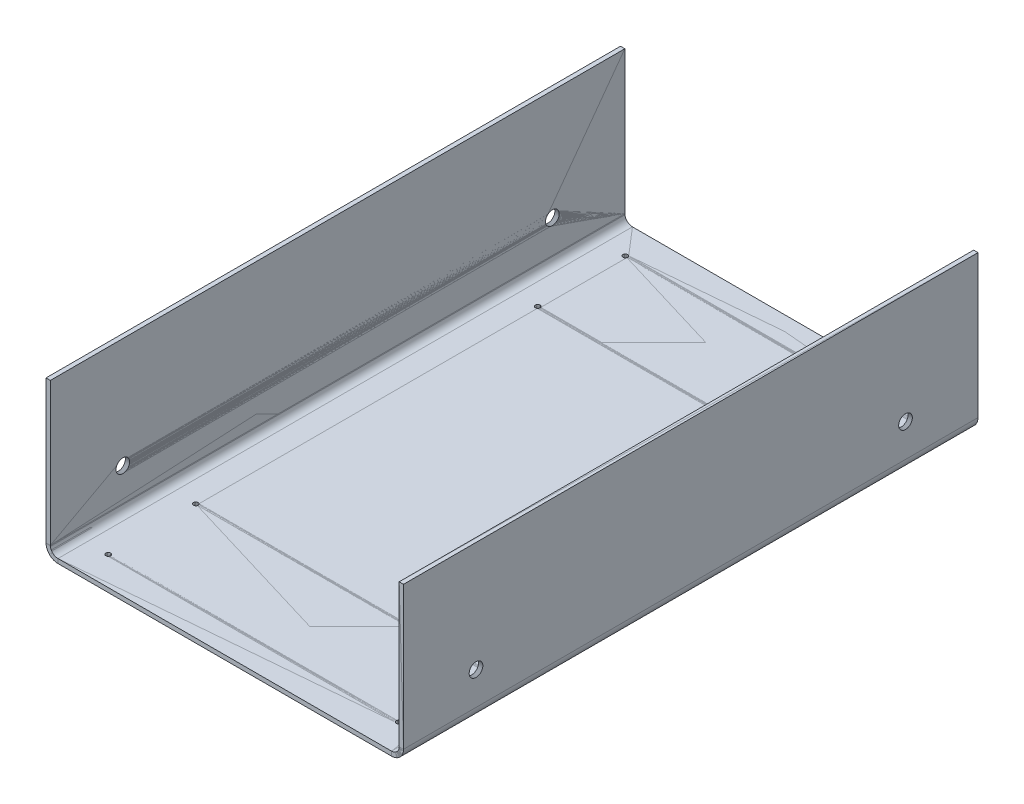
from build123d import *

# Parameters (mm, degrees)
BOSS_EXTRUDE1_DEPTH        = 420
INSIDE_FILLET_R            = 5.56
OUTSIDE_FILLET_R           = 8.73
BEARING_HOLES_REACH        = 508.763
SKETCH2_R                  = 5
MOTOR_MOUNT_HOLES_REACH    = 455.406
SKETCH3_R                  = 1.7526
CONVERT_SOLID1_START       = 34.5000001
CONVERT_SOLID1_OUTLINE_W   = 3.175
CONVERT_SOLID1_OUTLINE_H   = 420
CONVERT_SOLID1_DEPTH       = 75.4999999
CONVERT_SOLID1_START_2     = 5.56
CONVERT_SOLID1_2_OUTLINE_W = 3.175
CONVERT_SOLID1_2_OUTLINE_H = 420
CONVERT_SOLID1_2_DEPTH     = 18.9399999
CONVERT_SOLID1_START_3     = -3.175
CONVERT_SOLID1_3_OUTLINE_W = 261.35
CONVERT_SOLID1_3_OUTLINE_H = 420
CONVERT_SOLID1_3_OUTLINE_R = 1.7526
CONVERT_SOLID1_3_DEPTH     = 8.735
CONVERT_SOLID1_START_4     = 24.4999999
CONVERT_SOLID1_4_OUTLINE_W = 3.175
CONVERT_SOLID1_4_OUTLINE_H = 420
CONVERT_SOLID1_4_DEPTH     = 10.0000002
CONVERT_SOLID1_START_5     = -132
CONVERT_SOLID1_5_OUTLINE_R = 5
CONVERT_SOLID1_5_DEPTH     = 264
CONVERT_SOLID1_6_DEPTH     = 420


with BuildPart() as part:
    # Sketch1 → Boss-Extrude1 (new body)
    with BuildSketch(Plane.XY):
        Polygon((127.5, 110), (127.5, 0), (-127.5, 0), (-127.5, 110), (-130.68, 110), (-130.68, -3.18), (130.68, -3.18), (130.68, 110), align=None)
    extrude(amount=BOSS_EXTRUDE1_DEPTH)

    # Inside Fillet
    inside_fillet_edges = [part.edges().sort_by_distance(p)[0] for p in [
        (-127.5, 0, 210),
        (127.5, 0, 210),
    ]]
    fillet(inside_fillet_edges, radius=INSIDE_FILLET_R)

    # Outside Fillet
    outside_fillet_edges = [part.edges().sort_by_distance(p)[0] for p in [
        (130.68, -3.18, 210),
        (-130.68, -3.18, 210),
    ]]
    fillet(outside_fillet_edges, radius=OUTSIDE_FILLET_R)

    # Bearing Holes: up to this face of the body (flat: up to its plane)
    bearing_holes_end = Plane(part.part.faces().sort_by_distance((-130.68, 57.775, 210))[0])
    # Sketch2 → Bearing Holes (cut, up to the picked face)
    with BuildSketch(Plane(origin=(130.68, 0, 0), x_dir=(0, 0, -1), z_dir=(1, 0, 0)), mode=Mode.PRIVATE) as bearing_holes_sk1:
        with Locations((-367, 29.5)):
            Circle(SKETCH2_R)
    bearing_holes_tool1 = split(extrude(bearing_holes_sk1.sketch, amount=-BEARING_HOLES_REACH, mode=Mode.PRIVATE), bisect_by=bearing_holes_end, keep=Keep.BOTH, mode=Mode.PRIVATE)
    # Sketch2 → Bearing Holes (cut, up to the picked face)
    with BuildSketch(Plane(origin=(130.68, 0, 0), x_dir=(0, 0, -1), z_dir=(1, 0, 0)), mode=Mode.PRIVATE) as bearing_holes_sk2:
        with Locations((-53, 29.5)):
            Circle(SKETCH2_R)
    bearing_holes_tool2 = split(extrude(bearing_holes_sk2.sketch, amount=-BEARING_HOLES_REACH, mode=Mode.PRIVATE), bisect_by=bearing_holes_end, keep=Keep.BOTH, mode=Mode.PRIVATE)
    add(bearing_holes_tool1.solids().sort_by(Axis((130.68, 29.5, 367), (-1, 0, 0)))[0], mode=Mode.SUBTRACT)
    add(bearing_holes_tool2.solids().sort_by(Axis((130.68, 29.5, 53), (-1, 0, 0)))[0], mode=Mode.SUBTRACT)

    # Sketch3 → Motor Mount Holes (cut, up to next)
    with BuildSketch(Plane(origin=(0, 0, 0), x_dir=(1, 0, 0), z_dir=(0, 1, 0)), mode=Mode.PRIVATE) as motor_mount_holes_sk1:
        with Locations(Location((-106.15, -335, 0), (0, 0, 180))):
            Circle(SKETCH3_R)
    motor_mount_holes_tool1 = extrude(motor_mount_holes_sk1.sketch, amount=-MOTOR_MOUNT_HOLES_REACH, mode=Mode.PRIVATE) & part.part
    # Sketch3 → Motor Mount Holes (cut, up to next)
    with BuildSketch(Plane(origin=(0, 0, 0), x_dir=(1, 0, 0), z_dir=(0, 1, 0)), mode=Mode.PRIVATE) as motor_mount_holes_sk2:
        with Locations(Location((-106.15, -399, 0), (0, 0, 180))):
            Circle(SKETCH3_R)
    motor_mount_holes_tool2 = extrude(motor_mount_holes_sk2.sketch, amount=-MOTOR_MOUNT_HOLES_REACH, mode=Mode.PRIVATE) & part.part
    # Sketch3 → Motor Mount Holes (cut, up to next)
    with BuildSketch(Plane(origin=(0, 0, 0), x_dir=(1, 0, 0), z_dir=(0, 1, 0)), mode=Mode.PRIVATE) as motor_mount_holes_sk3:
        with Locations(Location((106.15, -399, 0), (0, 0, 270))):
            Circle(SKETCH3_R)
    motor_mount_holes_tool3 = extrude(motor_mount_holes_sk3.sketch, amount=-MOTOR_MOUNT_HOLES_REACH, mode=Mode.PRIVATE) & part.part
    # Sketch3 → Motor Mount Holes (cut, up to next)
    with BuildSketch(Plane(origin=(0, 0, 0), x_dir=(1, 0, 0), z_dir=(0, 1, 0)), mode=Mode.PRIVATE) as motor_mount_holes_sk4:
        with Locations(Location((106.15, -335, 0), (0, 0, 270))):
            Circle(SKETCH3_R)
    motor_mount_holes_tool4 = extrude(motor_mount_holes_sk4.sketch, amount=-MOTOR_MOUNT_HOLES_REACH, mode=Mode.PRIVATE) & part.part
    # Sketch3 → Motor Mount Holes (cut, up to next)
    with BuildSketch(Plane(origin=(0, 0, 0), x_dir=(1, 0, 0), z_dir=(0, 1, 0)), mode=Mode.PRIVATE) as motor_mount_holes_sk5:
        with Locations(Location((-106.15, -85, 0), (0, 0, 180))):
            Circle(SKETCH3_R)
    motor_mount_holes_tool5 = extrude(motor_mount_holes_sk5.sketch, amount=-MOTOR_MOUNT_HOLES_REACH, mode=Mode.PRIVATE) & part.part
    # Sketch3 → Motor Mount Holes (cut, up to next)
    with BuildSketch(Plane(origin=(0, 0, 0), x_dir=(1, 0, 0), z_dir=(0, 1, 0)), mode=Mode.PRIVATE) as motor_mount_holes_sk6:
        with Locations(Location((-106.15, -21, 0), (0, 0, 180))):
            Circle(SKETCH3_R)
    motor_mount_holes_tool6 = extrude(motor_mount_holes_sk6.sketch, amount=-MOTOR_MOUNT_HOLES_REACH, mode=Mode.PRIVATE) & part.part
    # Sketch3 → Motor Mount Holes (cut, up to next)
    with BuildSketch(Plane(origin=(0, 0, 0), x_dir=(1, 0, 0), z_dir=(0, 1, 0)), mode=Mode.PRIVATE) as motor_mount_holes_sk7:
        with Locations(Location((106.15, -21, 0), (0, 0, 270))):
            Circle(SKETCH3_R)
    motor_mount_holes_tool7 = extrude(motor_mount_holes_sk7.sketch, amount=-MOTOR_MOUNT_HOLES_REACH, mode=Mode.PRIVATE) & part.part
    # Sketch3 → Motor Mount Holes (cut, up to next)
    with BuildSketch(Plane(origin=(0, 0, 0), x_dir=(1, 0, 0), z_dir=(0, 1, 0)), mode=Mode.PRIVATE) as motor_mount_holes_sk8:
        with Locations(Location((106.15, -85, 0), (0, 0, 270))):
            Circle(SKETCH3_R)
    motor_mount_holes_tool8 = extrude(motor_mount_holes_sk8.sketch, amount=-MOTOR_MOUNT_HOLES_REACH, mode=Mode.PRIVATE) & part.part
    add(motor_mount_holes_tool1.solids().sort_by_distance((-106.15, 0, 335))[0], mode=Mode.SUBTRACT)
    add(motor_mount_holes_tool2.solids().sort_by_distance((-106.15, 0, 399))[0], mode=Mode.SUBTRACT)
    add(motor_mount_holes_tool3.solids().sort_by_distance((106.15, 0, 399))[0], mode=Mode.SUBTRACT)
    add(motor_mount_holes_tool4.solids().sort_by_distance((106.15, 0, 335))[0], mode=Mode.SUBTRACT)
    add(motor_mount_holes_tool5.solids().sort_by_distance((-106.15, 0, 85))[0], mode=Mode.SUBTRACT)
    add(motor_mount_holes_tool6.solids().sort_by_distance((-106.15, 0, 21))[0], mode=Mode.SUBTRACT)
    add(motor_mount_holes_tool7.solids().sort_by_distance((106.15, 0, 21))[0], mode=Mode.SUBTRACT)
    add(motor_mount_holes_tool8.solids().sort_by_distance((106.15, 0, 85))[0], mode=Mode.SUBTRACT)


with BuildPart() as body_2:
    # Convert-Solid1: read off the stored shape, not the designer's step
    # Convert-Solid1 outline → Convert-Solid1 (new body)
    with BuildSketch(Plane(origin=(0, 0, 0), x_dir=(1, 0, 0), z_dir=(0, 1, 0)).offset(CONVERT_SOLID1_START)):
        with Locations((129.0875, -210)):
            Rectangle(CONVERT_SOLID1_OUTLINE_W, CONVERT_SOLID1_OUTLINE_H)
        with Locations((-129.0875, -210)):
            Rectangle(CONVERT_SOLID1_OUTLINE_W, CONVERT_SOLID1_OUTLINE_H)
    extrude(amount=CONVERT_SOLID1_DEPTH)

    # Convert-Solid1 2 outline → Convert-Solid1 2 (add)
    with BuildSketch(Plane(origin=(0, 0, 0), x_dir=(1, 0, 0), z_dir=(0, 1, 0)).offset(CONVERT_SOLID1_START_2)):
        with Locations((129.0875, -210)):
            Rectangle(CONVERT_SOLID1_2_OUTLINE_W, CONVERT_SOLID1_2_OUTLINE_H)
        with Locations((-129.0875, -210)):
            Rectangle(CONVERT_SOLID1_2_OUTLINE_W, CONVERT_SOLID1_2_OUTLINE_H)
    extrude(amount=CONVERT_SOLID1_2_DEPTH)

    # Convert-Solid1 3 outline → Convert-Solid1 3 (add)
    with BuildSketch(Plane(origin=(0, 0, 0), x_dir=(1, 0, 0), z_dir=(0, 1, 0)).offset(CONVERT_SOLID1_START_3)):
        with Locations((0, -210)):
            Rectangle(CONVERT_SOLID1_3_OUTLINE_W, CONVERT_SOLID1_3_OUTLINE_H)
        with Locations((-106.15, -399)):
            Circle(CONVERT_SOLID1_3_OUTLINE_R, mode=Mode.SUBTRACT)
        with Locations((-106.15, -335)):
            Circle(CONVERT_SOLID1_3_OUTLINE_R, mode=Mode.SUBTRACT)
        with Locations((106.15, -399)):
            Circle(CONVERT_SOLID1_3_OUTLINE_R, mode=Mode.SUBTRACT)
        with Locations((106.15, -335)):
            Circle(CONVERT_SOLID1_3_OUTLINE_R, mode=Mode.SUBTRACT)
        with Locations((-106.15, -85)):
            Circle(CONVERT_SOLID1_3_OUTLINE_R, mode=Mode.SUBTRACT)
        with Locations((-106.15, -21)):
            Circle(CONVERT_SOLID1_3_OUTLINE_R, mode=Mode.SUBTRACT)
        with Locations((106.15, -85)):
            Circle(CONVERT_SOLID1_3_OUTLINE_R, mode=Mode.SUBTRACT)
        with Locations((106.15, -21)):
            Circle(CONVERT_SOLID1_3_OUTLINE_R, mode=Mode.SUBTRACT)
    extrude(amount=CONVERT_SOLID1_3_DEPTH)

    # Convert-Solid1 4 outline → Convert-Solid1 4 (add)
    with BuildSketch(Plane(origin=(0, 0, 0), x_dir=(1, 0, 0), z_dir=(0, 1, 0)).offset(CONVERT_SOLID1_START_4)):
        with Locations((129.0875, -210)):
            Rectangle(CONVERT_SOLID1_4_OUTLINE_W, CONVERT_SOLID1_4_OUTLINE_H)
        with Locations((-129.0875, -210)):
            Rectangle(CONVERT_SOLID1_4_OUTLINE_W, CONVERT_SOLID1_4_OUTLINE_H)
    extrude(amount=CONVERT_SOLID1_4_DEPTH)

    # Convert-Solid1 5 outline → Convert-Solid1 5 (cut)
    with BuildSketch(Plane.YZ.offset(CONVERT_SOLID1_START_5)):
        with Locations((29.5, 367)):
            Circle(CONVERT_SOLID1_5_OUTLINE_R)
        with Locations((29.5, 53)):
            Circle(CONVERT_SOLID1_5_OUTLINE_R)
    extrude(amount=CONVERT_SOLID1_5_DEPTH, mode=Mode.SUBTRACT)

    # Convert-Solid1 6 outline → Convert-Solid1 6 (cut)
    with BuildSketch(Plane.XY):
        with BuildLine():
            Line((127.5, 5.56), (-127.5, 5.56))
            ThreePointArc((-127.5, 5.56), (-125.871513703, 1.628486297), (-121.94, 0))
            Line((-121.94, 0), (121.94, 0))
            ThreePointArc((121.94, 0), (125.871513703, 1.628486297), (127.5, 5.56))
        make_face()
        with BuildLine():
            ThreePointArc((130.675, 5.56), (128.116577734, -0.616577734), (121.94, -3.175))
            Line((121.94, -3.175), (130.675, -3.175))
            Line((130.675, -3.175), (130.675, 5.56))
        make_face()
        with BuildLine():
            ThreePointArc((-121.94, -3.175), (-128.116577734, -0.616577734), (-130.675, 5.56))
            Line((-130.675, 5.56), (-130.675, -3.175))
            Line((-130.675, -3.175), (-121.94, -3.175))
        make_face()
    extrude(amount=CONVERT_SOLID1_6_DEPTH, mode=Mode.SUBTRACT)


solid = Compound([part.part, body_2.part])
